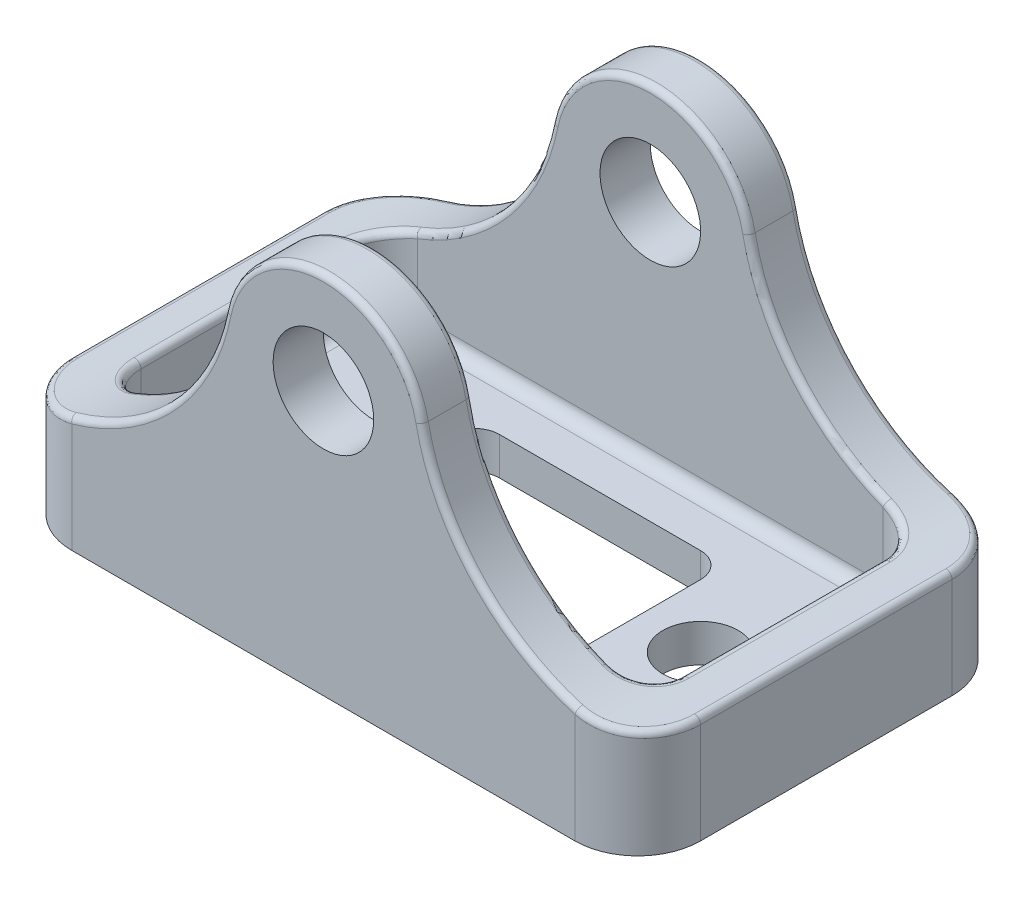
from build123d import *

# Parameters (mm, degrees)
SZKIC1_W                        = 50
SZKIC1_H                        = 29
SZKIC1_R                        = 4
DODANIE_WYCI_GNI_CIE1_DEPTH     = 30
SZKIC3_R                        = 3
WYTNIJ_WYCI_GNI_CIE1_DEPTH      = 49.641546028
WYTNIJ_WYCI_GNI_CIE2_START      = -3
SZKIC4_W                        = 43
SZKIC4_H                        = 22
WYTNIJ_WYCI_GNI_CIE2_DEPTH      = 46.641546028
WYTNIJ_WYCI_GNI_CIE3_DEPTH      = 49.641546028
WYTNIJ_WYCI_GNI_CIE3_DEPTH_BACK = 49.641546028
ZAOKR_GLENIE1_R                 = 1
WYTNIJ_WYCI_GNI_CIE4_DEPTH      = 10
ZAOKR_GLENIE2_R                 = 3
ZAOKR_GLENIE3_R                 = 5
ZAOKR_GLENIE4_R                 = 0.5


with BuildPart() as part:
    # Szkic1 → Dodanie-wyciągnięcie1 (new body)
    with BuildSketch(Plane.XY):
        with Locations((0, 14.5)):
            Rectangle(SZKIC1_W, SZKIC1_H)
        with Locations((0, 21)):
            Circle(SZKIC1_R, mode=Mode.SUBTRACT)
    extrude(amount=DODANIE_WYCI_GNI_CIE1_DEPTH)

    # Szkic3 → Wytnij-wyciągnięcie1 (cut, through all)
    with BuildSketch(Plane.XZ):
        with Locations((-15, 15)):
            Circle(SZKIC3_R)
        with Locations((15, 15)):
            Circle(SZKIC3_R)
    extrude(amount=-WYTNIJ_WYCI_GNI_CIE1_DEPTH, mode=Mode.SUBTRACT)

    # Szkic4 → Wytnij-wyciągnięcie2 (cut, through all)
    with BuildSketch(Plane.XZ.offset(WYTNIJ_WYCI_GNI_CIE2_START)):
        with Locations((0, 15)):
            Rectangle(SZKIC4_W, SZKIC4_H)
    extrude(amount=-WYTNIJ_WYCI_GNI_CIE2_DEPTH, mode=Mode.SUBTRACT)

    # Szkic5 → Wytnij-wyciągnięcie3 (cut, two sides: drawn at the far end of the back side and taken through both)
    with BuildSketch(Plane.XY.offset(30).offset(-WYTNIJ_WYCI_GNI_CIE3_DEPTH_BACK)):
        with BuildLine():
            Line((-25, 29), (-25, 8.504902432))
            ThreePointArc((-25, 8.504902432), (-13.908302239, 12.470303784), (-7.844645406, 22.568929081))
            ThreePointArc((-7.844645406, 22.568929081), (-5.071911245, 27.186737131), (0, 29))
            Line((0, 29), (-25, 29))
        make_face()
        with BuildLine():
            Line((25, 29), (0, 29))
            ThreePointArc((0, 29), (5.071911245, 27.186737131), (7.844645406, 22.568929081))
            ThreePointArc((7.844645406, 22.568929081), (13.908302239, 12.470303784), (25, 8.504902432))
            Line((25, 8.504902432), (25, 29))
        make_face()
    extrude(amount=WYTNIJ_WYCI_GNI_CIE3_DEPTH + WYTNIJ_WYCI_GNI_CIE3_DEPTH_BACK, mode=Mode.SUBTRACT)

    # Zaokrąglenie1
    zaokr_glenie1_edges = [part.edges().sort_by_distance(p)[0] for p in [
        (0, 3, 26),
        (0, 3, 4),
        (21.5, 3, 15),
        (-21.5, 3, 15),
    ]]
    fillet(zaokr_glenie1_edges, radius=ZAOKR_GLENIE1_R)

    # Szkic6 → Wytnij-wyciągnięcie4 (cut)
    with BuildSketch(Plane(origin=(0, 3, 0), x_dir=(1, 0, 0), z_dir=(0, 1, 0))):
        with BuildLine():
            Line((8, -22), (-8, -22))
            ThreePointArc((-8, -22), (-9.414213562, -21.414213562), (-10, -20))
            Line((-10, -20), (-10, -10))
            ThreePointArc((-10, -10), (-9.414213562, -8.585786438), (-8, -8))
            Line((-8, -8), (8, -8))
            ThreePointArc((8, -8), (9.414213562, -8.585786438), (10, -10))
            Line((10, -10), (10, -20))
            ThreePointArc((10, -20), (9.414213562, -21.414213562), (8, -22))
        make_face()
    extrude(amount=-WYTNIJ_WYCI_GNI_CIE4_DEPTH, mode=Mode.SUBTRACT)

    # Zaokrąglenie2
    # the kernel refuses this fillet: 3 mm, written as the material it adds along each edge
    with BuildSketch(Plane(origin=(18.5, 3, 23), x_dir=(1, 0, 0), z_dir=(0, 0, -1))) as zaokr_glenie2_piece_1:
        with BuildLine():
            CenterArc((2, -1), 1, 0, 90)
            Line((3, -1), (3, 0))
            Line((3, 0), (2, 0))
        make_face()
    revolve(axis=Axis((18.5, 3, 23), (0, -1, 0)), revolution_arc=90)
    with BuildSketch(Plane(origin=(18.5, 3, 7), x_dir=(0, 0, -1), z_dir=(-1, 0, 0))) as zaokr_glenie2_piece_2:
        with BuildLine():
            CenterArc((2, -1), 1, 0, 90)
            Line((3, -1), (3, 0))
            Line((3, 0), (2, 0))
        make_face()
    revolve(axis=Axis((18.5, 3, 7), (0, -1, 0)), revolution_arc=90)
    with BuildSketch(Plane(origin=(-18.5, 3, 23), x_dir=(0, 0, 1), z_dir=(1, 0, 0))) as zaokr_glenie2_piece_3:
        with BuildLine():
            CenterArc((2, -1), 1, 0, 90)
            Line((3, -1), (3, 0))
            Line((3, 0), (2, 0))
        make_face()
    revolve(axis=Axis((-18.5, 3, 23), (0, -1, 0)), revolution_arc=90)
    with BuildSketch(Plane(origin=(-18.5, 3, 7), x_dir=(-1, 0, 0), z_dir=(0, 0, 1))) as zaokr_glenie2_piece_4:
        with BuildLine():
            CenterArc((2, -1), 1, 0, 90)
            Line((3, -1), (3, 0))
            Line((3, 0), (2, 0))
        make_face()
    revolve(axis=Axis((-18.5, 3, 7), (0, -1, 0)), revolution_arc=90)
    with BuildSketch(Plane(origin=(-21.5, 3, 26), x_dir=(1, 0, 0), z_dir=(0, 1, 0))) as zaokr_glenie2_piece_5_section:
        with BuildLine():
            CenterArc((ZAOKR_GLENIE2_R, ZAOKR_GLENIE2_R), ZAOKR_GLENIE2_R, 180, 90)
            Line((0, ZAOKR_GLENIE2_R), (0, 0))
            Line((0, 0), (ZAOKR_GLENIE2_R, 0))
        make_face()
    zaokr_glenie2_piece_5 = extrude(amount=13.358575353, mode=Mode.PRIVATE)
    zaokr_glenie2_piece_5 = zaokr_glenie2_piece_5 - Plane(origin=(-25, 26, 25.331450014), x_dir=(0, -1, 0), z_dir=(0, 0, -1)) * Cylinder(17.495097568, 39, mode=Mode.PRIVATE)
    add(zaokr_glenie2_piece_5)
    with BuildSketch(Plane(origin=(-21.5, 3, 4), x_dir=(0, 0, 1), z_dir=(0, 1, 0))) as zaokr_glenie2_piece_6_section:
        with BuildLine():
            CenterArc((ZAOKR_GLENIE2_R, ZAOKR_GLENIE2_R), ZAOKR_GLENIE2_R, 180, 90)
            Line((0, ZAOKR_GLENIE2_R), (0, 0))
            Line((0, 0), (ZAOKR_GLENIE2_R, 0))
        make_face()
    zaokr_glenie2_piece_6 = extrude(amount=13.358575353, mode=Mode.PRIVATE)
    zaokr_glenie2_piece_6 = zaokr_glenie2_piece_6 - Plane(origin=(-25, 26, 4.668548884), x_dir=(0, -1, 0), z_dir=(0, 0, -1)) * Cylinder(17.495097568, 39, mode=Mode.PRIVATE)
    add(zaokr_glenie2_piece_6)
    with BuildSketch(Plane(origin=(21.5, 3, 26), x_dir=(-1, 0, 0), z_dir=(0, 1, 0))) as zaokr_glenie2_piece_7_section:
        with BuildLine():
            CenterArc((ZAOKR_GLENIE2_R, -ZAOKR_GLENIE2_R), ZAOKR_GLENIE2_R, 90, 90)
            Line((0, -ZAOKR_GLENIE2_R), (0, 0))
            Line((0, 0), (ZAOKR_GLENIE2_R, 0))
        make_face()
    zaokr_glenie2_piece_7 = extrude(amount=13.358575353, mode=Mode.PRIVATE)
    zaokr_glenie2_piece_7 = zaokr_glenie2_piece_7 - Plane(origin=(25, 26, 25.331452978), x_dir=(-0.98058067569092, -0.19611613513818515, 0), z_dir=(0, 0, -1)) * Cylinder(17.495097568, 39, mode=Mode.PRIVATE)
    add(zaokr_glenie2_piece_7)
    with BuildSketch(Plane(origin=(21.5, 3, 4), x_dir=(0, 0, 1), z_dir=(0, 1, 0))) as zaokr_glenie2_piece_8_section:
        with BuildLine():
            CenterArc((ZAOKR_GLENIE2_R, -ZAOKR_GLENIE2_R), ZAOKR_GLENIE2_R, 90, 90)
            Line((0, -ZAOKR_GLENIE2_R), (0, 0))
            Line((0, 0), (ZAOKR_GLENIE2_R, 0))
        make_face()
    zaokr_glenie2_piece_8 = extrude(amount=13.358575353, mode=Mode.PRIVATE)
    zaokr_glenie2_piece_8 = zaokr_glenie2_piece_8 - Plane(origin=(25, 26, 4.668547456), x_dir=(-0.98058067569092, -0.19611613513818515, 0), z_dir=(0, 0, -1)) * Cylinder(17.495097568, 39, mode=Mode.PRIVATE)
    add(zaokr_glenie2_piece_8)

    # Zaokrąglenie3
    zaokr_glenie3_edges = [part.edges().sort_by_distance(p)[0] for p in [
        (25, 4.252451216, 0),
        (-25, 4.252451216, 0),
        (-25, 4.252451216, 30),
        (25, 4.252451216, 30),
    ]]
    fillet(zaokr_glenie3_edges, radius=ZAOKR_GLENIE3_R)

    # Zaokrąglenie4
    zaokr_glenie4_edges = [part.edges().sort_by_distance(p)[0] for p in [
        (-21.5, 8.858575353, 15),
        (11.549013847, 14.812980271, 26),
        (11.549013847, 14.812980271, 4),
        (21.5, 8.858575353, 15),
        (25, 8.504902432, 15),
        (-12.070731734, 14.213886942, 0),
        (-25, 8.504902432, 15),
        (-12.070731734, 14.213886942, 30),
        (-11.549013847, 14.812980271, 26),
        (0, 29, 26),
        (0, 29, 4),
        (-11.549013847, 14.812980271, 4),
        (0, 29, 0),
        (12.070731734, 14.213886942, 30),
        (12.070731734, 14.213886942, 0),
    ]]
    fillet(zaokr_glenie4_edges, radius=ZAOKR_GLENIE4_R)


solid = part.part
